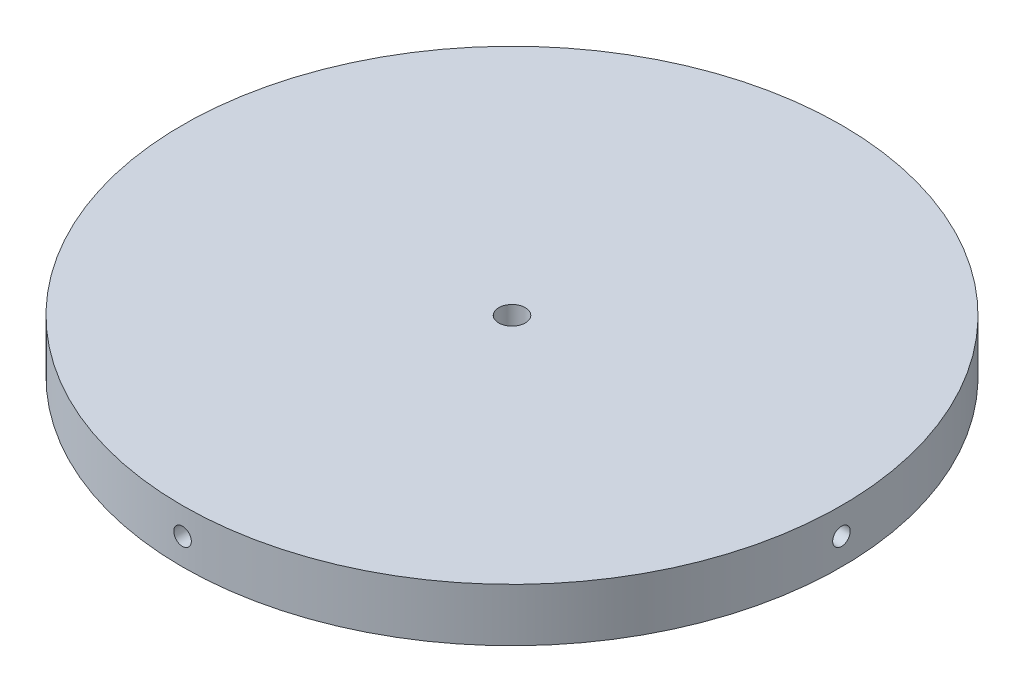
from build123d import *

# Parameters (mm, degrees)
SKETCH1_R                       = 62
BOSS_EXTRUDE1_DEPTH             = 5
M6_TAPPED_HOLE1_D               = 5
M4_TAPPED_HOLE1_D               = 3.3
M4_TAPPED_HOLE1_DEPTH           = 10.1
M4_TAPPED_HOLE1_TIP             = 0.991420021
M4_TAPPED_HOLE1_ON_FACE_2_D     = 3.3
M4_TAPPED_HOLE1_ON_FACE_2_DEPTH = 10.1
M4_TAPPED_HOLE1_ON_FACE_2_TIP   = 0.991420021
M4_TAPPED_HOLE1_ON_FACE_3_D     = 3.3
M4_TAPPED_HOLE1_ON_FACE_3_DEPTH = 10.1
M4_TAPPED_HOLE1_ON_FACE_3_TIP   = 0.991420021
M4_TAPPED_HOLE1_ON_FACE_4_D     = 3.3
M4_TAPPED_HOLE1_ON_FACE_4_DEPTH = 10.1
M4_TAPPED_HOLE1_ON_FACE_4_TIP   = 0.991420021


with BuildPart() as part:
    # Sketch1 → Boss-Extrude1 (new, symmetric)
    with BuildSketch(Plane(origin=(0, 0, 0), x_dir=(1, 0, 0), z_dir=(0, 1, 0))):
        Circle(SKETCH1_R)
    extrude(amount=BOSS_EXTRUDE1_DEPTH, both=True)

    # M6 Tapped Hole1 (through all)
    with Locations(Plane(origin=(0, 5, 0), x_dir=(1, 0, 0), z_dir=(0, 1, 0))):
        with Locations((0, 0)):
            Hole(M6_TAPPED_HOLE1_D / 2)

    # M4 Tapped Hole1
    with Locations(Plane(origin=(0, 0, -62), x_dir=(-1, 0, 0), z_dir=(0, 0, -1))):
        with Locations((0, 0)):
            Hole(M4_TAPPED_HOLE1_D / 2, depth=M4_TAPPED_HOLE1_DEPTH)
            with Locations((0, 0, -(M4_TAPPED_HOLE1_DEPTH + M4_TAPPED_HOLE1_TIP / 2))):  # 118° drill point
                Cone(0, M4_TAPPED_HOLE1_D / 2, M4_TAPPED_HOLE1_TIP, mode=Mode.SUBTRACT)

    # M4 Tapped Hole1 on face 2
    with Locations(Plane(origin=(-62, 0, 0), x_dir=(0, 0, -1), z_dir=(-1, 0, 0))):
        with Locations((0, 0)):
            Hole(M4_TAPPED_HOLE1_ON_FACE_2_D / 2, depth=M4_TAPPED_HOLE1_ON_FACE_2_DEPTH)
            with Locations((0, 0, -(M4_TAPPED_HOLE1_ON_FACE_2_DEPTH + M4_TAPPED_HOLE1_ON_FACE_2_TIP / 2))):  # 118° drill point
                Cone(0, M4_TAPPED_HOLE1_ON_FACE_2_D / 2, M4_TAPPED_HOLE1_ON_FACE_2_TIP, mode=Mode.SUBTRACT)

    # M4 Tapped Hole1 on face 3
    with Locations(Plane.XY.offset(62)):
        with Locations((0, 0)):
            Hole(M4_TAPPED_HOLE1_ON_FACE_3_D / 2, depth=M4_TAPPED_HOLE1_ON_FACE_3_DEPTH)
            with Locations((0, 0, -(M4_TAPPED_HOLE1_ON_FACE_3_DEPTH + M4_TAPPED_HOLE1_ON_FACE_3_TIP / 2))):  # 118° drill point
                Cone(0, M4_TAPPED_HOLE1_ON_FACE_3_D / 2, M4_TAPPED_HOLE1_ON_FACE_3_TIP, mode=Mode.SUBTRACT)

    # M4 Tapped Hole1 on face 4
    with Locations(Plane(origin=(62, 0, 0), x_dir=(0, 0, 1), z_dir=(1, 0, 0))):
        with Locations((0, 0)):
            Hole(M4_TAPPED_HOLE1_ON_FACE_4_D / 2, depth=M4_TAPPED_HOLE1_ON_FACE_4_DEPTH)
            with Locations((0, 0, -(M4_TAPPED_HOLE1_ON_FACE_4_DEPTH + M4_TAPPED_HOLE1_ON_FACE_4_TIP / 2))):  # 118° drill point
                Cone(0, M4_TAPPED_HOLE1_ON_FACE_4_D / 2, M4_TAPPED_HOLE1_ON_FACE_4_TIP, mode=Mode.SUBTRACT)


solid = part.part
